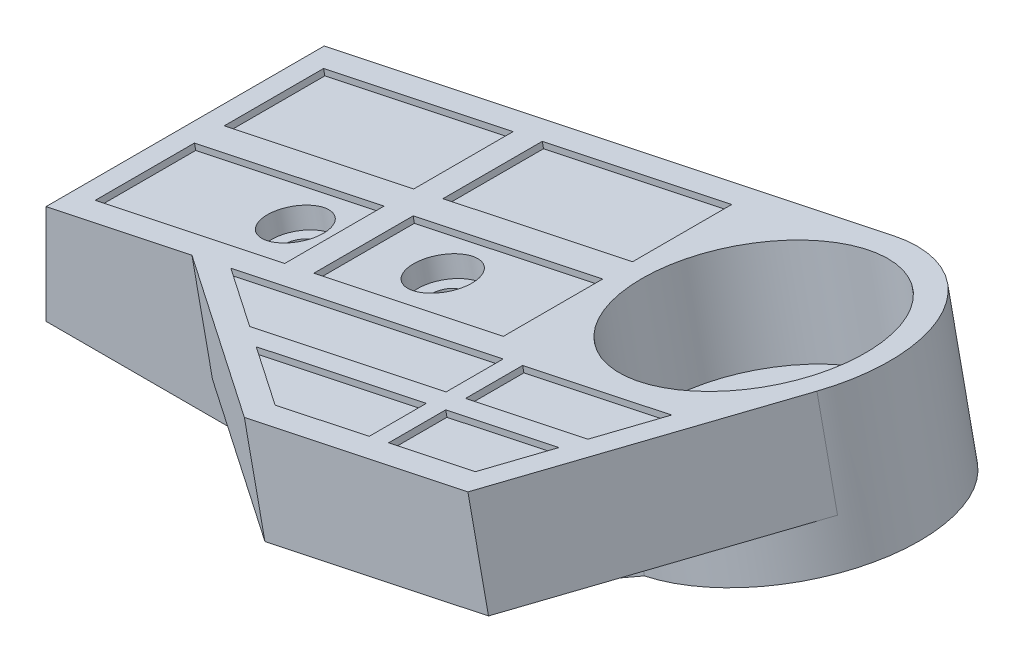
from build123d import *

# Parameters (mm, degrees)
SALIENTE_EXTRUIR1_DEPTH = 14
SALIENTE_EXTRUIR2_DEPTH = 14.497
SALIENTE_EXTRUIR3_DEPTH = 14
SALIENTE_EXTRUIR4_DEPTH = 16
CORTAR_EXTRUIR1_DEPTH   = 16
CORTAR_EXTRUIR3_DEPTH   = 16
SALIENTE_EXTRUIR5_DEPTH = 10
CROQUIS10_R             = 11.5
CORTAR_EXTRUIR4_DEPTH   = 10
CROQUIS11_R             = 1.5
CORTAR_EXTRUIR5_DEPTH   = 10
CROQUIS12_W             = 19.5
CROQUIS12_H             = 10
CORTAR_EXTRUIR6_DEPTH   = 0.6
CROQUIS13_R             = 3.0005
CORTAR_EXTRUIR7_DEPTH   = 2
CROQUIS14_R             = 1.5
CORTAR_EXTRUIR8_DEPTH   = 84.1308046
CROQUIS15_R             = 2.879821228
CORTAR_EXTRUIR9_DEPTH   = 2
CROQUIS16_R             = 1.5
CORTAR_EXTRUIR10_DEPTH  = 84.1308046
CORTAR_EXTRUIR11_DEPTH  = 97.804947367


with BuildPart() as part:
    # Croquis1 → Saliente-Extruir1 (new, symmetric)
    with BuildSketch(Plane.XY):
        Polygon((0, 10), (0, 0), (49, 0), (49, 20.362545892), align=None)
    saliente_extruir1 = extrude(amount=SALIENTE_EXTRUIR1_DEPTH, both=True)

    # Croquis3 → Saliente-Extruir2 (add)
    with BuildSketch(Plane(origin=(-2.024271727, 9.571905945, 0), x_dir=(0.9783611779651771, 0.20690433888778445, 0), z_dir=(-0.20690433888778445, 0.9783611779651771, 0))):
        with BuildLine():
            Line((44.319015144, -14), (60.569043389, -14))
            ThreePointArc((60.569043389, -14), (74.569043389, 0), (60.569043389, 14))
            Line((60.569043389, 14), (44.319015144, 14))
            Line((44.319015144, 14), (44.319015144, -14))
        make_face()
    saliente_extruir2 = extrude(amount=-SALIENTE_EXTRUIR2_DEPTH)

    # Croquis5 → Saliente-Extruir3 (add, symmetric)
    with BuildSketch(Plane.XY):
        Polygon((49, 6.954034303), (49, 1.5), (60.233736519, 7.920349276), align=None)
    saliente_extruir3 = extrude(amount=SALIENTE_EXTRUIR3_DEPTH, both=True)

    # Croquis6 → Saliente-Extruir4 (add)
    with BuildSketch(Plane(origin=(0, 0, -14), x_dir=(-1, 0, 0), z_dir=(0, 0, -1))):
        Polygon((-14.691071448, 13.106875553), (-16.760114837, 3.323263773), (-67.96558217, 14.152223062), (-65.896538781, 23.935834841), align=None)
    saliente_extruir4 = extrude(amount=SALIENTE_EXTRUIR4_DEPTH)

    # Croquis7 → Cortar-Extruir1 (cut)
    with BuildSketch(Plane(origin=(-2.024271727, 9.571905945, 0), x_dir=(0.9783611779651771, 0.20690433888778445, 0), z_dir=(-0.20690433888778445, 0.9783611779651771, 0))):
        Polygon((17.085043389, 14), (38.83360656, 30), (17.085043389, 30), align=None)
    cortar_extruir1 = extrude(amount=-CORTAR_EXTRUIR1_DEPTH, mode=Mode.SUBTRACT)

    # Croquis8 → Cortar-Extruir3 (cut)
    with BuildSketch(Plane(origin=(-2.024271727, 9.571905945, 0), x_dir=(0.9783611779651771, 0.20690433888778445, 0), z_dir=(-0.20690433888778445, 0.9783611779651771, 0))):
        Polygon((61.83360656, 30), (73.218033408, 6.000254286), (73.218033408, 30), align=None)
    cortar_extruir3 = extrude(amount=-CORTAR_EXTRUIR3_DEPTH, mode=Mode.SUBTRACT)

    # Croquis9 → Saliente-Extruir5 (add)
    with BuildSketch(Plane(origin=(-2.024271727, 9.571905945, 0), x_dir=(0.9783611779651771, 0.20690433888778445, 0), z_dir=(-0.20690433888778445, 0.9783611779651771, 0))):
        Polygon((61.83360656, 30), (73.218033408, 6.000254286), (49.824419891, 6.000254286), align=None)
    saliente_extruir5 = extrude(amount=-SALIENTE_EXTRUIR5_DEPTH)

    # Croquis10 → Cortar-Extruir4 (cut)
    with BuildSketch(Plane(origin=(-2.024271727, 9.571905945, 0), x_dir=(0.9783611779651771, 0.20690433888778445, 0), z_dir=(-0.20690433888778445, 0.9783611779651771, 0))):
        with Locations((60.569043389, 0)):
            Circle(CROQUIS10_R)
    cortar_extruir4 = extrude(amount=-CORTAR_EXTRUIR4_DEPTH, mode=Mode.SUBTRACT)

    # Croquis11 → Cortar-Extruir5 (cut)
    with BuildSketch(Plane(origin=(0.044771662, -0.211705834, 0), x_dir=(0.9783611779651771, 0.20690433888778445, 0), z_dir=(-0.20690433888778445, 0.9783611779651771, 0))):
        with Locations((60.569043389, 0)):
            Circle(CROQUIS11_R)
    cortar_extruir5 = extrude(amount=-CORTAR_EXTRUIR5_DEPTH, mode=Mode.SUBTRACT)

    # Croquis12 → Cortar-Extruir6 (cut)
    with BuildSketch(Plane(origin=(-2.024271727, 9.571905945, 0), x_dir=(0.9783611779651771, 0.20690433888778445, 0), z_dir=(-0.20690433888778445, 0.9783611779651771, 0))):
        with Locations((14.319043389, -6.5)):
            Rectangle(CROQUIS12_W, CROQUIS12_H)
        with Locations((36.819043389, 6.5)):
            Rectangle(CROQUIS12_W, CROQUIS12_H)
        with Locations((36.819043389, -6.5)):
            Rectangle(CROQUIS12_W, CROQUIS12_H)
        with Locations((14.319043389, 6.5)):
            Rectangle(CROQUIS12_W, CROQUIS12_H)
        Polygon((51.115043389, 19.75), (51.115043389, 14), (66.438043389, 14), (63.710043389, 19.75), align=None)
        Polygon((21.085043389, 14), (49.115043389, 14), (49.115043389, 19.75), (28.901043389, 19.75), align=None)
        Polygon((31.620043389, 21.75), (49.115043389, 21.75), (49.115043389, 27.5), (39.436043389, 27.5), align=None)
        Polygon((51.115043389, 27.5), (51.115043389, 21.75), (62.761043389, 21.75), (60.034043389, 27.5), align=None)
    cortar_extruir6 = extrude(amount=-CORTAR_EXTRUIR6_DEPTH, mode=Mode.SUBTRACT)

    # Croquis13 → Cortar-Extruir7 (cut)
    with BuildSketch(Plane(origin=(-1.900129124, 8.984889239, 0), x_dir=(0.9783611779651771, 0.20690433888778448, 0), z_dir=(-0.20690433888778448, 0.9783611779651771, 0))):
        with Locations((34.584043389, 6)):
            Circle(CROQUIS13_R)
    cortar_extruir7 = extrude(amount=-CORTAR_EXTRUIR7_DEPTH, mode=Mode.SUBTRACT)

    # Croquis14 → Cortar-Extruir8 (cut, through all)
    with BuildSketch(Plane(origin=(-1.486320446, 7.028166883, 0), x_dir=(0.9783611779651771, 0.20690433888778448, 0), z_dir=(-0.20690433888778448, 0.9783611779651771, 0))):
        with Locations((34.584043389, 6)):
            Circle(CROQUIS14_R)
    cortar_extruir8 = extrude(amount=-CORTAR_EXTRUIR8_DEPTH, mode=Mode.SUBTRACT)

    # Croquis15 → Cortar-Extruir9 (cut)
    with BuildSketch(Plane(origin=(-1.900129124, 8.984889239, 0), x_dir=(0.9783611779651771, 0.20690433888778448, 0), z_dir=(-0.20690433888778448, 0.9783611779651771, 0))):
        with Locations((19.384043389, 5.967)):
            Circle(CROQUIS15_R)
    cortar_extruir9 = extrude(amount=-CORTAR_EXTRUIR9_DEPTH, mode=Mode.SUBTRACT)

    # Croquis16 → Cortar-Extruir10 (cut, through all)
    with BuildSketch(Plane(origin=(-1.486320446, 7.028166883, 0), x_dir=(0.9783611779651771, 0.20690433888778448, 0), z_dir=(-0.20690433888778448, 0.9783611779651771, 0))):
        with Locations((19.384043389, 5.967)):
            Circle(CROQUIS16_R)
    cortar_extruir10 = extrude(amount=-CORTAR_EXTRUIR10_DEPTH, mode=Mode.SUBTRACT)

    # Simetría1: Saliente-Extruir1, Saliente-Extruir2, Saliente-Extruir3, Saliente-Extruir4, Cortar-Extruir1, Cortar-Extruir3, Saliente-Extruir5, Cortar-Extruir4, Cortar-Extruir5, Cortar-Extruir6, Cortar-Extruir7, Cortar-Extruir8, Cortar-Extruir9, Cortar-Extruir10 across plane
    add(saliente_extruir1.mirror(Plane.XY.offset(14)))
    add(saliente_extruir2.mirror(Plane.XY.offset(14)))
    add(saliente_extruir3.mirror(Plane.XY.offset(14)))
    add(saliente_extruir4.mirror(Plane.XY.offset(14)))
    add(cortar_extruir1.mirror(Plane.XY.offset(14)), mode=Mode.SUBTRACT)
    add(cortar_extruir3.mirror(Plane.XY.offset(14)), mode=Mode.SUBTRACT)
    add(saliente_extruir5.mirror(Plane.XY.offset(14)))
    add(cortar_extruir4.mirror(Plane.XY.offset(14)), mode=Mode.SUBTRACT)
    add(cortar_extruir5.mirror(Plane.XY.offset(14)), mode=Mode.SUBTRACT)
    add(cortar_extruir6.mirror(Plane.XY.offset(14)), mode=Mode.SUBTRACT)
    add(cortar_extruir7.mirror(Plane.XY.offset(14)), mode=Mode.SUBTRACT)
    add(cortar_extruir8.mirror(Plane.XY.offset(14)), mode=Mode.SUBTRACT)
    add(cortar_extruir9.mirror(Plane.XY.offset(14)), mode=Mode.SUBTRACT)
    add(cortar_extruir10.mirror(Plane.XY.offset(14)), mode=Mode.SUBTRACT)

    # Croquis17 → Cortar-Extruir11 (cut, through all)
    with BuildSketch(Plane(origin=(-2.024271727, 9.571905945, 0), x_dir=(0.9783611779651771, 0.20690433888778445, 0), z_dir=(-0.20690433888778445, 0.9783611779651771, 0))):
        Polygon((60.569043389, -14), (2.069043389, -14), (-8.374716356, -14), (-8.374716356, 46.052665743), (2.069043389, 46.052665743), (94.22647489, 46.052665743), (94.22647489, -14), align=None)
    extrude(amount=-CORTAR_EXTRUIR11_DEPTH, mode=Mode.SUBTRACT)


solid = part.part
